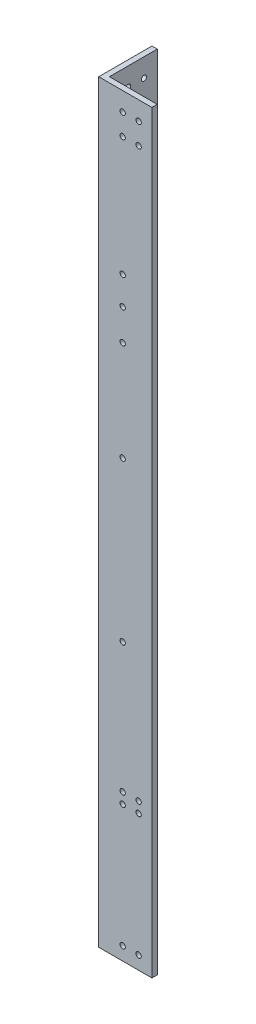
from build123d import *

# Parameters (mm, degrees)
BOSS_EXTRUDE1_DEPTH               = 450
FRONTSIDEHOLES_SKETCH3_R          = 1.5875
FRONTSIDEHOLES_CUT_EXTRUDE1_DEPTH = 3.175
LEFTSIDEHOLES_SKETCH4_R           = 1.5875
LEFTSIDEHOLES_CUT_EXTRUDE2_DEPTH  = 3.175


with BuildPart() as part:
    # Sketch2 → Boss-Extrude1 (new body)
    with BuildSketch(Plane(origin=(0, 0, 0), x_dir=(1, 0, 0), z_dir=(0, 1, 0))):
        Polygon((0, 31.75), (3.175, 31.75), (3.175, 3.175), (31.75, 3.175), (31.75, 0), (0, 0), align=None)
    extrude(amount=BOSS_EXTRUDE1_DEPTH)

    # FrontSideHoles-Sketch3 → FrontSideHoles-Cut-Extrude1 (cut)
    with BuildSketch(Plane.XY):
        with Locations((14.2875, 81.1125)):
            Circle(FRONTSIDEHOLES_SKETCH3_R)
        with Locations((23.8125, 81.1125)):
            Circle(FRONTSIDEHOLES_SKETCH3_R)
        with Locations((14.2875, 87.4625)):
            Circle(FRONTSIDEHOLES_SKETCH3_R)
        with Locations((23.8125, 87.4625)):
            Circle(FRONTSIDEHOLES_SKETCH3_R)
        with Locations((14.2875, 438.8875)):
            Circle(FRONTSIDEHOLES_SKETCH3_R)
        with Locations((14.2875, 426.1875)):
            Circle(FRONTSIDEHOLES_SKETCH3_R)
        with Locations((23.8125, 438.8875)):
            Circle(FRONTSIDEHOLES_SKETCH3_R)
        with Locations((23.8125, 426.1875)):
            Circle(FRONTSIDEHOLES_SKETCH3_R)
        with Locations((14.2875, 338.177644)):
            Circle(FRONTSIDEHOLES_SKETCH3_R)
        with Locations((14.2875, 319.652644)):
            Circle(FRONTSIDEHOLES_SKETCH3_R)
        with Locations((14.2875, 260)):
            Circle(FRONTSIDEHOLES_SKETCH3_R)
        with Locations((14.2875, 165)):
            Circle(FRONTSIDEHOLES_SKETCH3_R)
        with Locations((14.2875, 355)):
            Circle(FRONTSIDEHOLES_SKETCH3_R)
        with Locations((14.2875, 7.9375)):
            Circle(FRONTSIDEHOLES_SKETCH3_R)
        with Locations((23.8125, 7.9375)):
            Circle(FRONTSIDEHOLES_SKETCH3_R)
    extrude(amount=-FRONTSIDEHOLES_CUT_EXTRUDE1_DEPTH, mode=Mode.SUBTRACT)

    # LeftSideHoles-Sketch4 → LeftSideHoles-Cut-Extrude2 (cut)
    with BuildSketch(Plane.ZY):
        with Locations((-23.8125, 81.1125)):
            Circle(LEFTSIDEHOLES_SKETCH4_R)
        with Locations((-14.2875, 81.1125)):
            Circle(LEFTSIDEHOLES_SKETCH4_R)
        with Locations((-23.8125, 87.4625)):
            Circle(LEFTSIDEHOLES_SKETCH4_R)
        with Locations((-14.2875, 87.4625)):
            Circle(LEFTSIDEHOLES_SKETCH4_R)
        with Locations((-23.8125, 438.8875)):
            Circle(LEFTSIDEHOLES_SKETCH4_R)
        with Locations((-14.2875, 438.8875)):
            Circle(LEFTSIDEHOLES_SKETCH4_R)
        with Locations((-23.8125, 426.1875)):
            Circle(LEFTSIDEHOLES_SKETCH4_R)
        with Locations((-14.2875, 426.1875)):
            Circle(LEFTSIDEHOLES_SKETCH4_R)
        with Locations((-23.8125, 332.602644)):
            Circle(LEFTSIDEHOLES_SKETCH4_R)
        with Locations((-14.2875, 332.602644)):
            Circle(LEFTSIDEHOLES_SKETCH4_R)
        with Locations((-23.8125, 319.902644)):
            Circle(LEFTSIDEHOLES_SKETCH4_R)
        with Locations((-14.2875, 319.902644)):
            Circle(LEFTSIDEHOLES_SKETCH4_R)
        with Locations((-23.8125, 7.9375)):
            Circle(LEFTSIDEHOLES_SKETCH4_R)
        with Locations((-14.2875, 7.9375)):
            Circle(LEFTSIDEHOLES_SKETCH4_R)
    extrude(amount=-LEFTSIDEHOLES_CUT_EXTRUDE2_DEPTH, mode=Mode.SUBTRACT)


solid = part.part
